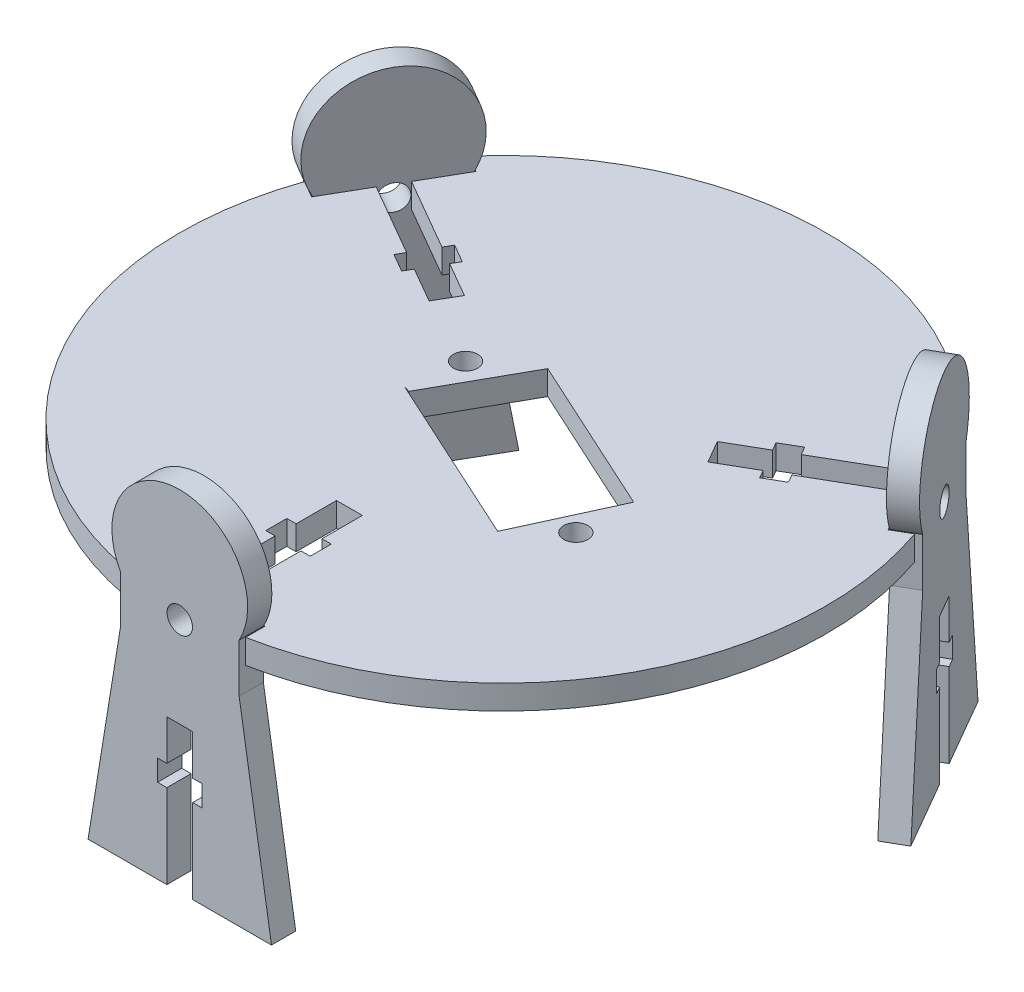
from build123d import *

# Parameters (mm, degrees)
SKETCH1_R          = 40
BASE_FLANGE1_DEPTH = 3
SKETCH9_R          = 1.5
CUT_EXTRUDE2_DEPTH = 3
BASE_FLANGE2_DEPTH = 3
CIRPATTERN3_COUNT  = 3
CUT_EXTRUDE5_DEPTH = 4
CUT_EXTRUDE6_DEPTH = 3
SKETCH41_R         = 1.575
CUT_EXTRUDE7_DEPTH = 5
CIRPATTERN4_COUNT  = 3
CUT_EXTRUDE8_DEPTH = 5
SKETCH43_R         = 1.575
CUT_EXTRUDE9_DEPTH = 5


# Sheet-metal steps are written as plain solids
with BuildPart() as part:
    # Sketch1 → Base-Flange1 (new body)
    with BuildSketch(Plane(origin=(0, 0, 0), x_dir=(1, 0, 0), z_dir=(0, 1, 0))):
        with Locations(Location((0, 0, 0), (0, 0, 270))):
            Circle(SKETCH1_R)
        Polygon((16.510145392, -1.788190184), (16.926601074, -0.879034167), (16.968246643, -0.788118565), (-2.663247704, 8.204099852), (-2.712004351, 8.116791265), (-8.826020957, -2.831585964), (-9.653679096, -2.56245401), (11.679259475, -12.33439999), (11.720905044, -12.243484388), align=None, mode=Mode.SUBTRACT)
    extrude(amount=-BASE_FLANGE1_DEPTH)

    # Sketch9 → Cut-Extrude2 (cut)
    with BuildSketch(Plane.XZ.offset(3)):
        with Locations(Location((-8.541520786, -3.912601137, 0), (0, 0, 270))):
            Circle(SKETCH9_R)
        with Locations(Location((16.642100904, 7.623221268, 0), (0, 0, 270))):
            Circle(SKETCH9_R)
    extrude(amount=-CUT_EXTRUDE2_DEPTH, mode=Mode.SUBTRACT)

    # Sketch25 → Cut-Extrude5 (cut)
    with BuildSketch(Plane(origin=(0, 0, 0), x_dir=(1, 0, 0), z_dir=(0, 1, 0))):
        Polygon((38.316016151, 13.634713282), (35.71793994, 12.134713282), (28.36793994, 24.865286718), (30.966016151, 26.365286718), (30.916016151, 26.451889258), (28.2313374, 24.901889258), (35.6813374, 11.998110742), (38.366016151, 13.548110742), align=None)
        Polygon((-7.35, -40), (-7.35, -37), (7.35, -37), (7.35, -40), (7.45, -40), (7.45, -36.9), (-7.45, -36.9), (-7.45, -40), align=None)
        Polygon((-30.966016151, 26.365286718), (-28.36793994, 24.865286718), (-35.71793994, 12.134713282), (-38.316016151, 13.634713282), (-38.366016151, 13.548110742), (-35.6813374, 11.998110742), (-28.2313374, 24.901889258), (-30.916016151, 26.451889258), align=None)
    extrude(amount=-CUT_EXTRUDE5_DEPTH, mode=Mode.SUBTRACT)


with BuildPart() as body_2:
    # Sketch10 → Base-Flange2 (new body)
    with BuildSketch(Plane.XY.offset(37)):
        with BuildLine():
            Line((7.35, -6), (11.35, -30.677925359))
            Line((11.35, -30.677925359), (1.6, -30.677925359))
            Line((1.6, -30.677925359), (1.6, -20.277925359))
            Line((1.6, -20.277925359), (2.75, -20.277925359))
            Line((2.75, -20.277925359), (2.75, -17.677925359))
            Line((2.75, -17.677925359), (1.6, -17.677925359))
            Line((1.6, -17.677925359), (1.6, -12.677925359))
            Line((1.6, -12.677925359), (-1.6, -12.677925359))
            Line((-1.6, -12.677925359), (-1.6, -17.677925359))
            Line((-1.6, -17.677925359), (-2.75, -17.677925359))
            Line((-2.75, -17.677925359), (-2.75, -20.277925359))
            Line((-2.75, -20.277925359), (-1.6, -20.277925359))
            Line((-1.6, -20.277925359), (-1.6, -30.677925359))
            Line((-1.6, -30.677925359), (-11.35, -30.677925359))
            Line((-11.35, -30.677925359), (-7.35, -6))
            Line((-7.35, -6), (-7.35, 0))
            ThreePointArc((-7.35, 0), (0, 12.466632514), (7.35, 0))
            Line((7.35, 0), (7.35, -6))
        make_face()
    extrude(amount=BASE_FLANGE2_DEPTH)


with BuildPart() as cirpattern3_1:
    # CirPattern3: pattern copy
    add(body_2.part.rotate(Axis((0, 0, 0), (0, 1, 0)), 1 * 360 / CIRPATTERN3_COUNT))


with BuildPart() as cirpattern3_2:
    # CirPattern3: pattern copy
    add(body_2.part.rotate(Axis((0, 0, 0), (0, 1, 0)), 2 * 360 / CIRPATTERN3_COUNT))


with BuildPart() as cut_extrude5_piece_1:
    # of the separate pieces the step leaves, piece 1, a body of its own (cut_extrude5_pieces)
    add(part.part.solids().sort_by_distance((7.45, 0, 39.30009542))[0])

    # Sketch40 → Cut-Extrude6 (cut)
    with BuildSketch(Plane(origin=(0, 0, 0), x_dir=(1, 0, 0), z_dir=(0, 1, 0))):
        Polygon((0, -37), (1.6, -37), (1.6, -26.6), (2.75, -26.6), (2.75, -24), (1.6, -24), (1.6, -19), (-1.6, -19), (-1.6, -24), (-2.75, -24), (-2.75, -26.6), (-1.6, -26.6), (-1.6, -37), align=None)
    cut_extrude6 = extrude(amount=-CUT_EXTRUDE6_DEPTH, mode=Mode.SUBTRACT)

    # CirPattern4: Cut-Extrude6 ×3 about axis
    cirpattern4_axis = Axis((0, 0, 0), (0, 1, 0))
    for i in range(1, CIRPATTERN4_COUNT):
        add(cut_extrude6.rotate(cirpattern4_axis, i * 360 / CIRPATTERN4_COUNT), mode=Mode.SUBTRACT)


with BuildPart() as cut_extrude5_piece_2:
    # of the separate pieces the step leaves, piece 2, a body of its own (cut_extrude5_pieces)
    add(part.part.solids().sort_by_distance((-30.3761839, 0, -26.024746909))[0])


with BuildPart() as cut_extrude5_piece_3:
    # of the separate pieces the step leaves, piece 3, a body of its own (cut_extrude5_pieces)
    add(part.part.solids().sort_by_distance((37.7261839, 0, -13.294173473))[0])


with BuildPart() as cut_extrude5_piece_4:
    # of the separate pieces the step leaves, piece 4, a body of its own (cut_extrude5_pieces)
    add(part.part.solids().sort_by_distance((7.35, 0, 39.318920382))[0])


with BuildPart() as body_2_1:
    add(body_2.part)

    # Combine1: union Cut-Extrude5 piece 4
    add(cut_extrude5_piece_4.part)

    # Sketch41 → Cut-Extrude7 (cut)
    with BuildSketch(Plane(origin=(0, 0, 37), x_dir=(-1, 0, 0), z_dir=(0, 0, -1))):
        with Locations((0, -1.5)):
            Circle(SKETCH41_R)
    extrude(amount=-CUT_EXTRUDE7_DEPTH, mode=Mode.SUBTRACT)


with BuildPart() as cirpattern3_1_1:
    add(cirpattern3_1.part)

    # Combine2: union Cut-Extrude5 piece 3
    add(cut_extrude5_piece_3.part)

    # Sketch43 → Cut-Extrude9 (cut)
    with BuildSketch(Plane(origin=(32.04293994, 0, -18.5), x_dir=(0.500000000000004, 0, 0.8660254037844364), z_dir=(-0.8660254037844365, 0, 0.500000000000004))):
        with Locations((0, -1.5)):
            Circle(SKETCH43_R)
    extrude(amount=-CUT_EXTRUDE9_DEPTH, mode=Mode.SUBTRACT)


with BuildPart() as cirpattern3_2_1:
    add(cirpattern3_2.part)

    # Combine3: union Cut-Extrude5 piece 2
    add(cut_extrude5_piece_2.part)

    # Sketch42 → Cut-Extrude8 (cut)
    with BuildSketch(Plane(origin=(-32.04293994, 0, -18.5), x_dir=(0.49999999999999195, 0, -0.8660254037844434), z_dir=(0.8660254037844434, 0, 0.49999999999999195))):
        with BuildLine():
            ThreePointArc((1.575, -1.5), (1.464638731, -0.920812305), (1.149021097, -0.422792722))
            Line((1.149021097, -0.422792722), (-1.149021097, -2.577207278))
            ThreePointArc((-1.149021097, -2.577207278), (0.579187695, -2.964638731), (1.575, -1.5))
        make_face()
        with BuildLine():
            Line((-1.149021097, -2.577207278), (1.149021097, -0.422792722))
            ThreePointArc((1.149021097, -0.422792722), (-1.077207278, -0.350978903), (-1.149021097, -2.577207278))
        make_face()
    extrude(amount=-CUT_EXTRUDE8_DEPTH, mode=Mode.SUBTRACT)


solid = Compound([cut_extrude5_piece_1.part, body_2_1.part, cirpattern3_1_1.part, cirpattern3_2_1.part])
